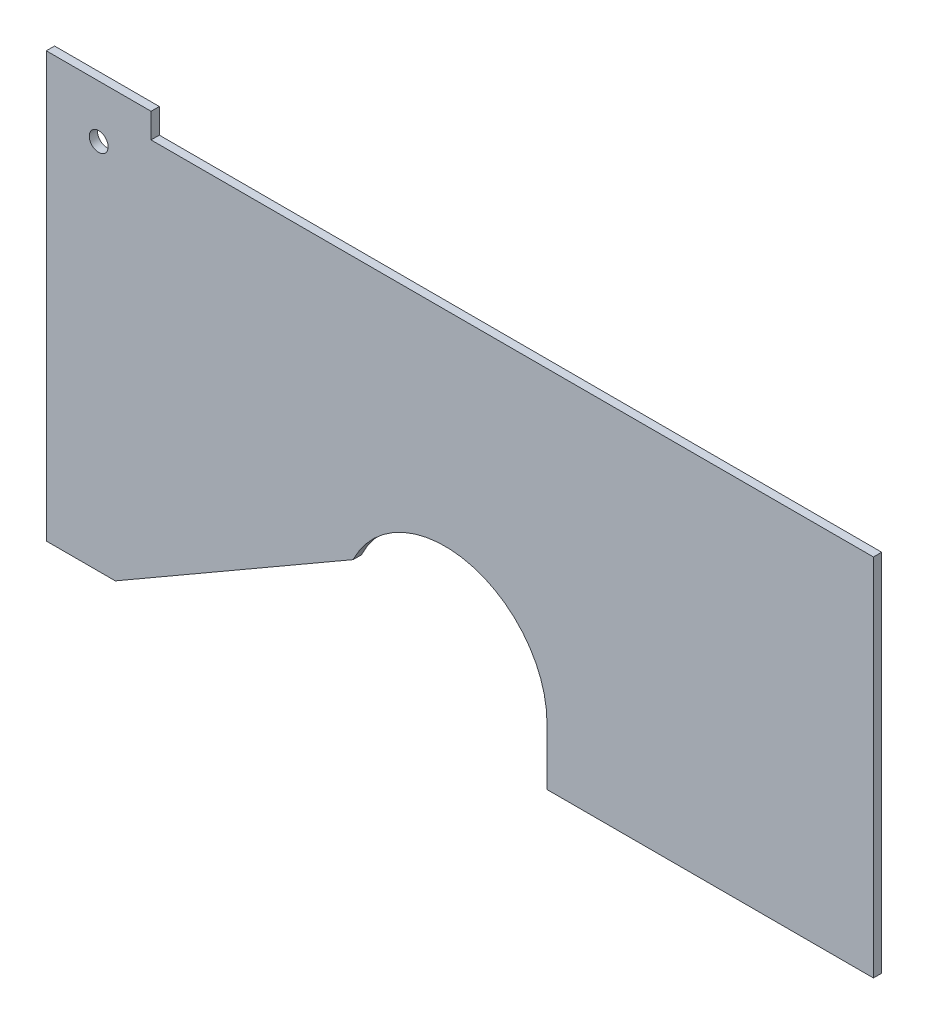
from build123d import *

# Parameters (mm, degrees)
SKETCH2_R           = 3.425
BOSS_EXTRUDE2_DEPTH = 3
SKETCH3_W           = 118.4
SKETCH3_H           = 12.75
CUT_EXTRUDE1_DEPTH  = 338.231374578


with BuildPart() as part:
    # Sketch2 → Boss-Extrude2 (new body)
    with BuildSketch(Plane.XY):
        with BuildLine():
            Line((25.03035901, 0), (111.286489227, 49.8))
            ThreePointArc((111.286489227, 49.8), (152.858332199, 69.766604349), (181.6, 33.7))
            Line((181.6, 33.7), (181.6, 0))
            Line((181.6, 0), (300, 0))
            Line((300, 0), (300, 145))
            Line((300, 145), (38, 145))
            Line((38, 145), (38, 154))
            Line((38, 154), (19, 154))
            Line((19, 154), (0, 154))
            Line((0, 154), (0, 0))
            Line((0, 0), (25.03035901, 0))
        make_face()
        with Locations((19, 135)):
            Circle(SKETCH2_R, mode=Mode.SUBTRACT)
    extrude(amount=BOSS_EXTRUDE2_DEPTH)

    # Sketch3 → Cut-Extrude1 (cut, through all)
    with BuildSketch(Plane.XY.offset(3)):
        with Locations((240.8, 6.375)):
            Rectangle(SKETCH3_W, SKETCH3_H)
    extrude(amount=-CUT_EXTRUDE1_DEPTH, mode=Mode.SUBTRACT)


solid = part.part
